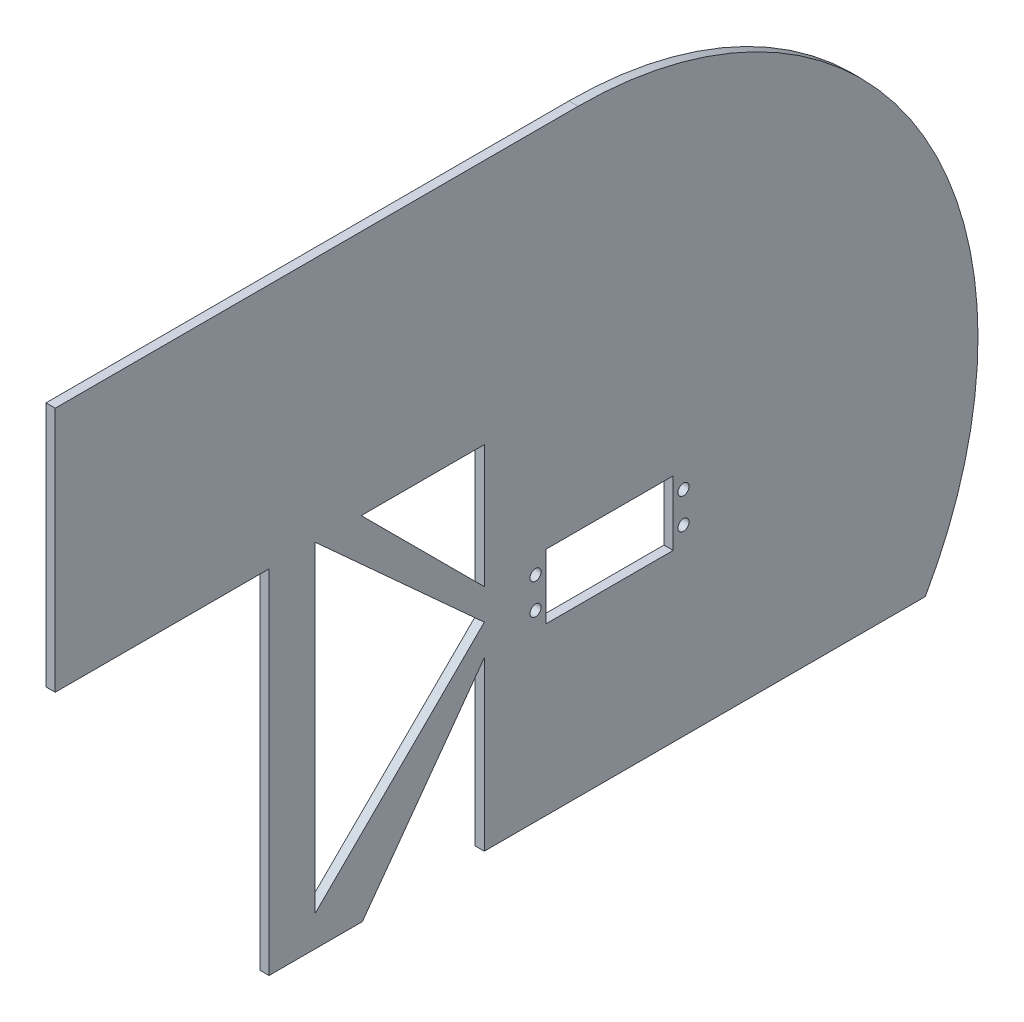
from build123d import *

# Parameters (mm, degrees)
SKETCH1_R           = 5
BOSS_EXTRUDE1_DEPTH = 3
SKETCH2_R           = 1.8
SKETCH2_W           = 41.4
SKETCH2_H           = 21
SERVOHOLE_DEPTH     = 215.030371677
SKETCH3_W           = 322.70302131
SKETCH3_H           = 65.5
CUT_EXTRUDE2_DEPTH  = 215.030371677
SKETCH4_W           = 69.5
SKETCH4_H           = 115
CUT_EXTRUDE5_DEPTH  = 215.030371677


with BuildPart() as part:
    # Sketch1 → Boss-Extrude1 (new body)
    with BuildSketch(Plane(origin=(0, 0, 0), x_dir=(0, 0, -1), z_dir=(1, 0, 0))):
        with BuildLine():
            Line((0, 130), (-170, 130))
            Line((-170, 130), (-170, 50))
            Line((-170, 50), (-120, 50))
            ThreePointArc((-120, 50), (72.111025509, -108.166538264), (0, 130))
        make_face()
        Circle(SKETCH1_R, mode=Mode.SUBTRACT)
    extrude(amount=BOSS_EXTRUDE1_DEPTH)

    # Sketch2 → ServoHole (cut, through all)
    with BuildSketch(Plane(origin=(3, 0, 0), x_dir=(0, 0, -1), z_dir=(1, 0, 0))):
        with Locations((-13.85, 5)):
            Circle(SKETCH2_R)
        with Locations((-13.85, -5)):
            Circle(SKETCH2_R)
        with Locations((34.25, 5)):
            Circle(SKETCH2_R)
        with Locations((34.25, -5)):
            Circle(SKETCH2_R)
        with Locations((10.2, 0)):
            Rectangle(SKETCH2_W, SKETCH2_H)
    extrude(amount=-SERVOHOLE_DEPTH, mode=Mode.SUBTRACT)

    # Sketch3 → Cut-Extrude2 (cut, through all)
    with BuildSketch(Plane(origin=(3, 0, 0), x_dir=(0, 0, -1), z_dir=(1, 0, 0))):
        with Locations((-37.404207891, -97.25)):
            Rectangle(SKETCH3_W, SKETCH3_H)
    extrude(amount=-CUT_EXTRUDE2_DEPTH, mode=Mode.SUBTRACT)

    # Sketch4 → Cut-Extrude5 (cut, through all)
    with BuildSketch(Plane(origin=(3, 0, 0), x_dir=(0, 0, -1), z_dir=(1, 0, 0))):
        with Locations((-135.25, -7.5)):
            Rectangle(SKETCH4_W, SKETCH4_H)
        Polygon((-30.5, 50), (-30.5, 10), (-70.5, 50), align=None)
        Polygon((-85.5, 50), (-30.5, 0), (-85.5, -54.5), align=None)
        Polygon((-30.5, -10), (-70.5, -65), (-30.5, -65), align=None)
    extrude(amount=-CUT_EXTRUDE5_DEPTH, mode=Mode.SUBTRACT)


solid = part.part
